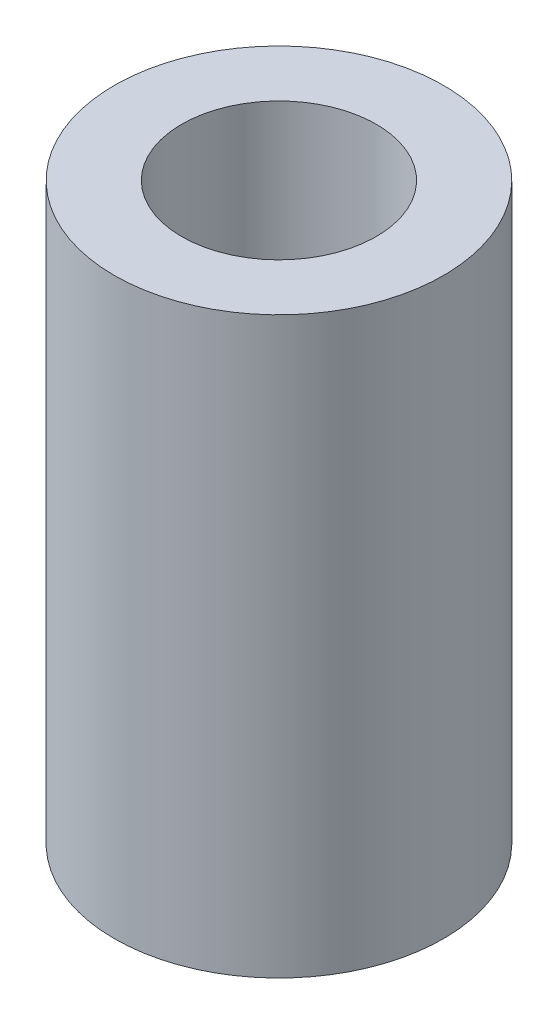
from build123d import *

# Parameters (mm, degrees)
SKETCH1_R           = 20
BOSS_EXTRUDE1_DEPTH = 69.777917143
SKETCH2_R           = 11.824120473
CUT_EXTRUDE1_DEPTH  = 76.292481171


with BuildPart() as part:
    # Sketch1 → Boss-Extrude1 (new body)
    with BuildSketch(Plane(origin=(0, 0, 0), x_dir=(1, 0, 0), z_dir=(0, 1, 0))):
        Circle(SKETCH1_R)
    extrude(amount=BOSS_EXTRUDE1_DEPTH)

    # Sketch2 → Cut-Extrude1 (cut, through all)
    with BuildSketch(Plane(origin=(0, 0, 0), x_dir=(1, 0, 0), z_dir=(0, 1, 0))):
        Circle(SKETCH2_R)
    extrude(amount=CUT_EXTRUDE1_DEPTH, mode=Mode.SUBTRACT)


solid = part.part
